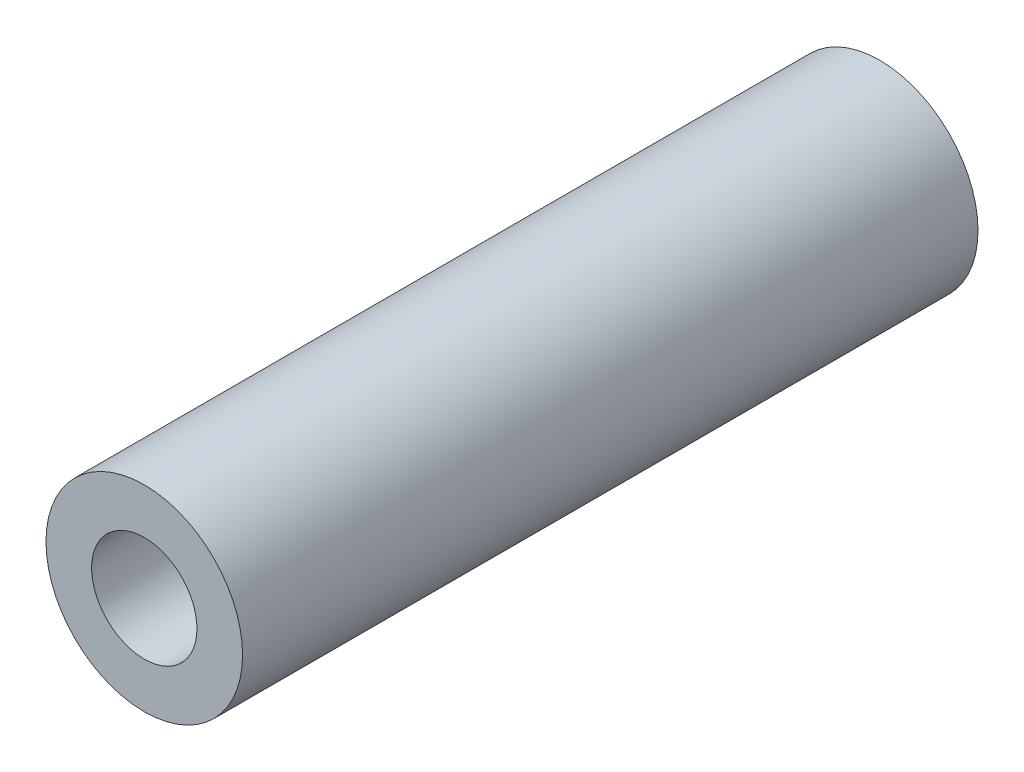
from build123d import *

# Parameters (mm, degrees)
SKETCH1_R           = 4.7625
SKETCH1_R_2         = 2.5527
BOSS_EXTRUDE1_DEPTH = 17.818735


with BuildPart() as part:
    # Sketch1 → Boss-Extrude1 (new, symmetric)
    with BuildSketch(Plane.XY):
        Circle(SKETCH1_R)
        Circle(SKETCH1_R_2, mode=Mode.SUBTRACT)
    extrude(amount=BOSS_EXTRUDE1_DEPTH, both=True)


solid = part.part
